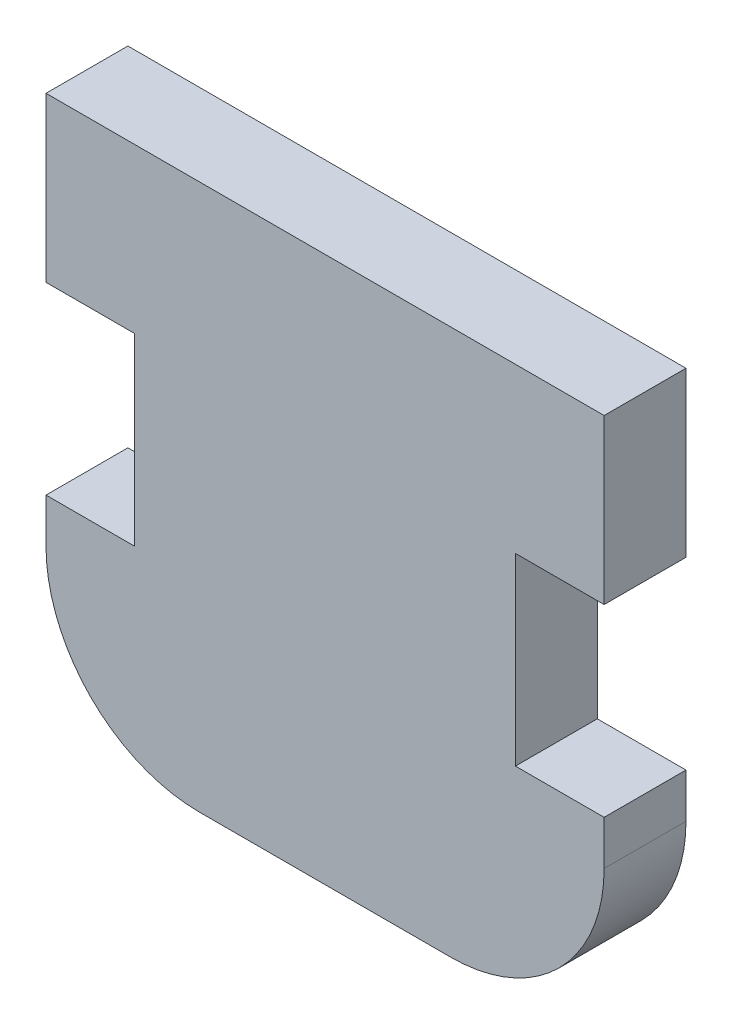
from build123d import *

# Parameters (mm, degrees)
BOSS_EXTRUDE1_DEPTH = 3.048
SKETCH2_W           = 3.556
SKETCH2_H           = 6.858
CUT_EXTRUDE1_DEPTH  = 454.766547869


with BuildPart() as part:
    # Sketch1 → Boss-Extrude1 (new body)
    with BuildSketch(Plane.XY):
        with BuildLine():
            Line((-435.5719, 0), (-432.5239, 0))
            Line((-432.5239, 0), (-432.5239, -6.35))
            Line((-432.5239, -6.35), (-432.5239, -12.7))
            Line((-432.5239, -12.7), (-432.5239, -14.605))
            ThreePointArc((-432.5239, -14.605), (-434.197784746, -18.646115254), (-438.2389, -20.32))
            Line((-438.2389, -20.32), (-447.5861, -20.32))
            ThreePointArc((-447.5861, -20.32), (-451.627215254, -18.646115254), (-453.3011, -14.605))
            Line((-453.3011, -14.605), (-453.3011, -12.7))
            Line((-453.3011, -12.7), (-453.3011, -6.35))
            Line((-453.3011, -6.35), (-453.3011, 0))
            Line((-453.3011, 0), (-450.2531, 0))
            Line((-450.2531, 0), (-435.5719, 0))
        make_face()
    extrude(amount=BOSS_EXTRUDE1_DEPTH)

    # Sketch2 → Cut-Extrude1 (cut, through all)
    with BuildSketch(Plane.XY.offset(3.048)):
        with Locations((-434.0479, -9.525)):
            Rectangle(SKETCH2_W, SKETCH2_H)
        with Locations((-451.7771, -9.525)):
            Rectangle(SKETCH2_W, SKETCH2_H)
    extrude(amount=-CUT_EXTRUDE1_DEPTH, mode=Mode.SUBTRACT)


solid = part.part
